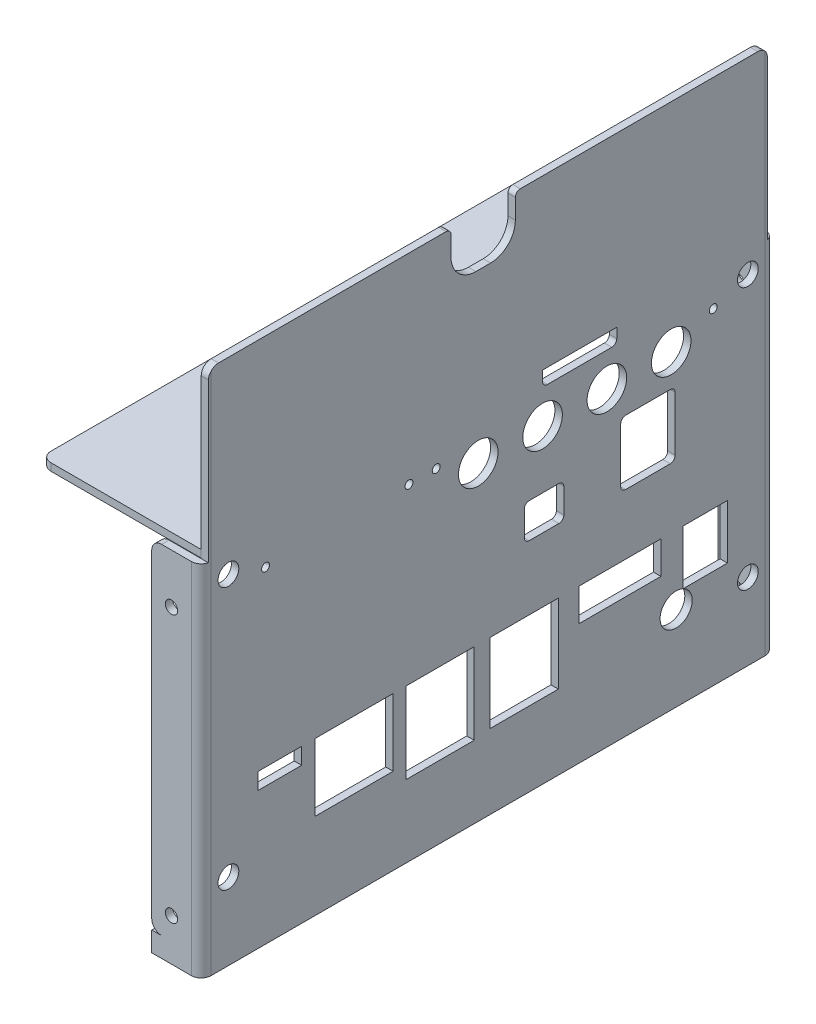
from build123d import *

# Parameters (mm, degrees)
CROQUIS1_W                          = 82.4
CROQUIS1_H                          = 70
SALIENTE_EXTRUIR1_DEPTH             = 34
CROQUIS2_W                          = 15
CROQUIS2_H                          = 70
CORTAR_EXTRUIR1_DEPTH               = 0.1
CROQUIS3_W                          = 1.5
CROQUIS3_H                          = 15
CORTAR_EXTRUIR2_DEPTH               = 1.5
CORTAR_EXTRUIR3_DEPTH               = 68.5
CROQUIS5_W                          = 1.5
CROQUIS5_H                          = 15
CORTAR_EXTRUIR4_DEPTH               = 3
SALIENTE_EXTRUIR2_DEPTH             = 30.4
CROQUIS7_W                          = 1.5
CROQUIS7_H                          = 68.5
SALIENTE_EXTRUIR3_DEPTH             = 1.6
CROQUIS8_W                          = 1.5
CROQUIS8_H                          = 68.5
SALIENTE_EXTRUIR4_DEPTH             = 8.5
CROQUIS9_W                          = 1.5
CROQUIS9_H                          = 68.5
SALIENTE_EXTRUIR5_DEPTH             = 1.6
CROQUIS10_W                         = 1.5
CROQUIS10_H                         = 68.5
SALIENTE_EXTRUIR6_DEPTH             = 8.5
CROQUIS11_W                         = 10
CROQUIS11_H                         = 13
CORTAR_EXTRUIR5_DEPTH               = 108.142428571
CROQUIS12_W                         = 8
CROQUIS12_H                         = 7
CORTAR_EXTRUIR6_DEPTH               = 84.025598462
CROQUIS13_W                         = 11
CROQUIS13_H                         = 13
CORTAR_EXTRUIR7_DEPTH               = 84.025598462
CORTAR_EXTRUIR8_DEPTH               = 84.025598462
CROQUIS15_W                         = 13.55
CROQUIS15_H                         = 6
CORTAR_EXTRUIR9_DEPTH               = 84.025598462
CROQUIS16_W                         = 13.55
CROQUIS16_H                         = 6
CORTAR_EXTRUIR10_DEPTH              = 84.025598462
CORTAR_EXTRUIR11_DEPTH              = 84.025598462
CROQUIS18_W                         = 26.5
CROQUIS18_H                         = 6.5
CORTAR_EXTRUIR12_DEPTH              = 84.025598462
CROQUIS19_W                         = 26.5
CROQUIS19_H                         = 6.5
CORTAR_EXTRUIR13_DEPTH              = 84.025598462
CORTAR_EXTRUIR14_DEPTH              = 83.42269105
DI_METRO_DE_TALADRO_8_0_8_1_D       = 8
DI_METRO_DE_TALADRO_6_5_6_5_1_D     = 6.5
DI_METRO_DE_TALADRO_2_5_2_5_1_D     = 2.5
DI_METRO_DE_TALADRO_2_5_2_5_1_DEPTH = 1.5
DI_METRO_DE_TALADRO_2_5_2_5_2_D     = 2.5
DI_METRO_DE_TALADRO_4_2_4_2_1_D     = 4.2
DI_METRO_DE_TALADRO_1_6_1_6_1_D     = 1.6
REDONDEO1_R                         = 0.3
REDONDEO2_R                         = 0.6
REDONDEO3_R                         = 0.8
REDONDEO4_R                         = 1
REDONDEO5_R                         = 1.5
REDONDEO6_R                         = 2
REDONDEO7_R                         = 5
SALIENTE_EXTRUIR7_DEPTH             = 4
CROQUIS38_W                         = 73.889858769
CROQUIS38_H                         = 28.929758263
SALIENTE_EXTRUIR8_DEPTH             = 1.5
CROQUIS39_W                         = 8.790000004
CROQUIS39_H                         = 3.326200024
CROQUIS39_W_2                       = 15.787775455
CROQUIS39_H_2                       = 13.619982862
CROQUIS39_W_3                       = 13.8
CROQUIS39_H_3                       = 16.3862
CROQUIS39_H_4                       = 15.9362
CROQUIS39_W_4                       = 16.586962118
CROQUIS39_H_5                       = 6.568107071
CROQUIS39_W_5                       = 9
CROQUIS39_H_6                       = 10.97
CORTAR_EXTRUIR15_DEPTH              = 1.5
CROQUIS45_W                         = 1.5
CROQUIS45_H                         = 113
SALIENTE_EXTRUIR9_DEPTH             = 34
REDONDEO8_R                         = 2
CROQUIS46_W                         = 13
CROQUIS46_H                         = 10
CORTAR_EXTRUIR16_DEPTH              = 1.5
REDONDEO9_R                         = 1
REDONDEO10_R                        = 5
REDONDEO11_START                    = -52
REDONDEO11_DEPTH                    = 107


with BuildPart() as part:
    # Croquis1 → Saliente-Extruir1 (new body)
    with BuildSketch(Plane(origin=(57.5, 0, 0), x_dir=(0, 0, -1), z_dir=(1, 0, 0))):
        with Locations((-16.2, -12.5)):
            Rectangle(CROQUIS1_W, CROQUIS1_H)
    extrude(amount=-SALIENTE_EXTRUIR1_DEPTH)

    # Croquis2 → Cortar-Extruir1 (cut)
    with BuildSketch(Plane(origin=(56, 0, 0), x_dir=(0, 0, -1), z_dir=(1, 0, 0))):
        with Locations((17.5, -12.5)):
            Rectangle(CROQUIS2_W, CROQUIS2_H)
    extrude(amount=-CORTAR_EXTRUIR1_DEPTH, mode=Mode.SUBTRACT)

    # Croquis3 → Cortar-Extruir2 (cut)
    with BuildSketch(Plane(origin=(0, 22.5, 0), x_dir=(-1, 0, 0), z_dir=(0, 1, 0))):
        with Locations((-56.75, -17.5)):
            Rectangle(CROQUIS3_W, CROQUIS3_H)
    extrude(amount=-CORTAR_EXTRUIR2_DEPTH, mode=Mode.SUBTRACT)

    # Croquis4 → Cortar-Extruir3 (cut)
    with BuildSketch(Plane.XZ.offset(47.5)):
        Polygon((23.5, -25), (55.9, -25), (55.9, -10), (56, -10), (56, 57.4), (23.5, 57.4), align=None)
    extrude(amount=-CORTAR_EXTRUIR3_DEPTH, mode=Mode.SUBTRACT)

    # Croquis5 → Cortar-Extruir4 (cut)
    with BuildSketch(Plane(origin=(0, 21, 0), x_dir=(-1, 0, 0), z_dir=(0, 1, 0))):
        with Locations((-56.75, -17.5)):
            Rectangle(CROQUIS5_W, CROQUIS5_H)
    extrude(amount=-CORTAR_EXTRUIR4_DEPTH, mode=Mode.SUBTRACT)

    # Croquis6 → Saliente-Extruir2 (add)
    with BuildSketch(Plane(origin=(0, 0, -25), x_dir=(-1, 0, 0), z_dir=(0, 0, -1))):
        Polygon((-57.5, 22.5), (-23.5, 22.5), (-23.5, 21), (-56, 21), (-56, -47.5), (-57.5, -47.5), align=None)
    extrude(amount=SALIENTE_EXTRUIR2_DEPTH)

    # Croquis7 → Saliente-Extruir3 (add)
    with BuildSketch(Plane(origin=(0, 0, -55.4), x_dir=(-1, 0, 0), z_dir=(0, 0, -1))):
        with Locations((-56.75, -13.25)):
            Rectangle(CROQUIS7_W, CROQUIS7_H)
    extrude(amount=SALIENTE_EXTRUIR3_DEPTH)

    # Croquis8 → Saliente-Extruir4 (add)
    with BuildSketch(Plane.ZY.offset(-56)):
        with Locations((-56.25, -13.25)):
            Rectangle(CROQUIS8_W, CROQUIS8_H)
    extrude(amount=SALIENTE_EXTRUIR4_DEPTH)

    # Croquis9 → Saliente-Extruir5 (add)
    with BuildSketch(Plane.XY.offset(57.4)):
        with Locations((56.75, -13.25)):
            Rectangle(CROQUIS9_W, CROQUIS9_H)
    extrude(amount=SALIENTE_EXTRUIR5_DEPTH)

    # Croquis10 → Saliente-Extruir6 (add)
    with BuildSketch(Plane.ZY.offset(-56)):
        with Locations((58.25, -13.25)):
            Rectangle(CROQUIS10_W, CROQUIS10_H)
    extrude(amount=SALIENTE_EXTRUIR6_DEPTH)

    # Croquis11 → Cortar-Extruir5 (cut, through all)
    with BuildSketch(Plane.XZ.offset(-21)):
        with Locations((28.5, 1)):
            Rectangle(CROQUIS11_W, CROQUIS11_H)
    extrude(amount=-CORTAR_EXTRUIR5_DEPTH, mode=Mode.SUBTRACT)

    # Croquis12 → Cortar-Extruir6 (cut, through all)
    with BuildSketch(Plane(origin=(57.5, 0, 0), x_dir=(0, 0, -1), z_dir=(1, 0, 0))):
        with Locations((10.3, -4)):
            Rectangle(CROQUIS12_W, CROQUIS12_H)
    extrude(amount=-CORTAR_EXTRUIR6_DEPTH, mode=Mode.SUBTRACT)

    # Croquis13 → Cortar-Extruir7 (cut, through all)
    with BuildSketch(Plane(origin=(57.5, 0, 0), x_dir=(0, 0, -1), z_dir=(1, 0, 0))):
        with Locations((31.3, -1.8)):
            Rectangle(CROQUIS13_W, CROQUIS13_H)
    extrude(amount=-CORTAR_EXTRUIR7_DEPTH, mode=Mode.SUBTRACT)

    # Croquis14 → Cortar-Extruir8 (cut, through all)
    with BuildSketch(Plane(origin=(57.5, 0, 0), x_dir=(0, 0, -1), z_dir=(1, 0, 0))):
        Polygon((15.700301919, -27.5), (25.899698081, -27.5), (27.125480126, -26.163699024), (28.6, -25.510897439), (28.6, -21.3), (13, -21.3), (13, -25.510897439), (14.474519874, -26.163699024), align=None)
    extrude(amount=-CORTAR_EXTRUIR8_DEPTH, mode=Mode.SUBTRACT)

    # Croquis15 → Cortar-Extruir9 (cut, through all)
    with BuildSketch(Plane(origin=(57.5, 0, 0), x_dir=(0, 0, -1), z_dir=(1, 0, 0))):
        with Locations((-17.1, -20.65)):
            Rectangle(CROQUIS15_W, CROQUIS15_H)
    extrude(amount=-CORTAR_EXTRUIR9_DEPTH, mode=Mode.SUBTRACT)

    # Croquis16 → Cortar-Extruir10 (cut, through all)
    with BuildSketch(Plane(origin=(57.5, 0, 0), x_dir=(0, 0, -1), z_dir=(1, 0, 0))):
        with Locations((-17.1, -29.15)):
            Rectangle(CROQUIS16_W, CROQUIS16_H)
    extrude(amount=-CORTAR_EXTRUIR10_DEPTH, mode=Mode.SUBTRACT)

    # Croquis17 → Cortar-Extruir11 (cut, through all)
    with BuildSketch(Plane(origin=(57.5, 0, 0), x_dir=(0, 0, -1), z_dir=(1, 0, 0))):
        Polygon((-5.75, -31.4), (8.95, -31.4), (8.95, -21.4), (4.1, -21.4), (4.1, -20.2), (-0.9, -20.2), (-0.9, -21.4), (-5.75, -21.4), align=None)
    extrude(amount=-CORTAR_EXTRUIR11_DEPTH, mode=Mode.SUBTRACT)

    # Croquis18 → Cortar-Extruir12 (cut, through all)
    with BuildSketch(Plane(origin=(57.5, 0, 0), x_dir=(0, 0, -1), z_dir=(1, 0, 0))):
        with Locations((-15.25, -38.85)):
            Rectangle(CROQUIS18_W, CROQUIS18_H)
    extrude(amount=-CORTAR_EXTRUIR12_DEPTH, mode=Mode.SUBTRACT)

    # Croquis19 → Cortar-Extruir13 (cut, through all)
    with BuildSketch(Plane(origin=(57.5, 0, 0), x_dir=(0, 0, -1), z_dir=(1, 0, 0))):
        with Locations((13.25, -38.85)):
            Rectangle(CROQUIS19_W, CROQUIS19_H)
    extrude(amount=-CORTAR_EXTRUIR13_DEPTH, mode=Mode.SUBTRACT)

    # Croquis20 → Cortar-Extruir14 (cut, through all)
    with BuildSketch(Plane.ZY.offset(-56)):
        Polygon((35.43492424, -26.5), (36.5, -25.43492424), (36.5, -20.8), (27.9, -20.8), (27.9, -25.43492424), (28.96507576, -26.5), align=None)
    extrude(amount=-CORTAR_EXTRUIR14_DEPTH, mode=Mode.SUBTRACT)

    # Diámetro de taladro Ø8.0 (8)1 (through all)
    with Locations(Plane.ZY.offset(-56)):
        with Locations((-23, 11.2), (3, 11.2), (-36, 11.2), (-10, 11.2)):
            Hole(DI_METRO_DE_TALADRO_8_0_8_1_D / 2)

    # Diámetro de taladro Ø6.5 (6.5)1 (through all)
    with Locations(Plane.ZY.offset(-56)):
        with Locations((-37, -34.4)):
            Hole(DI_METRO_DE_TALADRO_6_5_6_5_1_D / 2)

    # Diámetro de taladro Ø2.5 (2.5)1
    with Locations(Plane(origin=(0, 0, 57.5), x_dir=(-1, 0, 0), z_dir=(0, 0, -1))):
        with Locations((-51.5, -43), (-51.5, 11)):
            Hole(DI_METRO_DE_TALADRO_2_5_2_5_1_D / 2, depth=DI_METRO_DE_TALADRO_2_5_2_5_1_DEPTH)

    # Diámetro de taladro Ø2.5 (2.5)2 (through all)
    with Locations(Plane.XY.offset(-55.5)):
        with Locations((51.5, -43), (51.5, 11)):
            Hole(DI_METRO_DE_TALADRO_2_5_2_5_2_D / 2)

    # Diámetro de taladro Ø4.2 (4.2)1 (through all)
    with Locations(Plane.ZY.offset(-56)):
        with Locations((53.5, 17), (53.5, -36), (-51.5, 17), (-51.5, -36)):
            Hole(DI_METRO_DE_TALADRO_4_2_4_2_1_D / 2)

    # Diámetro de taladro Ø1.6 (1.6)1 (through all)
    with Locations(Plane.ZY.offset(-56)):
        with Locations((11.5, 14.5), (-44.5, 14.5), (46, 14.5), (17, 14.5)):
            Hole(DI_METRO_DE_TALADRO_1_6_1_6_1_D / 2)

    # Redondeo1
    redondeo1_edges = [part.edges().sort_by_distance(p)[0] for p in [
        (56.75, -20.2, 0.9),
        (56.75, -20.2, -4.1),
    ]]
    fillet(redondeo1_edges, radius=REDONDEO1_R)

    # Redondeo2
    redondeo2_edges = [part.edges().sort_by_distance(p)[0] for p in [
        (56.75, -23.65, 23.875),
        (56.75, -17.65, 23.875),
        (56.75, -17.65, 10.325),
        (56.75, -23.65, 10.325),
        (56.75, -32.15, 23.875),
        (56.75, -26.15, 23.875),
        (56.75, -26.15, 10.325),
        (56.75, -32.15, 10.325),
    ]]
    fillet(redondeo2_edges, radius=REDONDEO2_R)

    # Redondeo3
    redondeo3_edges = [part.edges().sort_by_distance(p)[0] for p in [
        (56.75, -31.4, 5.75),
        (56.75, -21.4, 5.75),
        (56.75, -21.4, 0.9),
        (56.75, -21.4, -4.1),
        (56.75, -21.4, -8.95),
        (56.75, -31.4, -8.95),
        (56.75, -20.8, 27.9),
        (56.75, -20.8, 36.5),
    ]]
    fillet(redondeo3_edges, radius=REDONDEO3_R)

    # Redondeo4
    redondeo4_edges = [part.edges().sort_by_distance(p)[0] for p in [
        (23.5, 21.75, 7.5),
        (23.5, 21.75, -5.5),
        (56.75, -7.5, -14.3),
        (56.75, -7.5, -6.3),
        (56.75, -0.5, -6.3),
        (56.75, -0.5, -14.3),
        (56.75, 4.7, -36.8),
        (56.75, -8.3, -36.8),
        (56.75, -8.3, -25.8),
        (56.75, 4.7, -25.8),
        (56.75, -27.5, -15.700301919),
        (56.75, -26.163699024, -14.474519874),
        (56.75, -25.510897439, -13),
        (56.75, -21.3, -13),
        (56.75, -21.3, -28.6),
        (56.75, -25.510897439, -28.6),
        (56.75, -26.163699024, -27.125480126),
        (56.75, -27.5, -25.899698081),
        (56.75, -35.6, 28.5),
        (56.75, -35.6, 2),
        (56.75, -42.1, 2),
        (56.75, -42.1, 28.5),
        (56.75, -42.1, 0),
        (56.75, -35.6, 0),
        (56.75, -35.6, -26.5),
        (56.75, -42.1, -26.5),
        (56.75, -26.5, 35.43492424),
        (56.75, -26.5, 28.96507576),
        (56.75, -25.43492424, 27.9),
        (56.75, -25.43492424, 36.5),
        (56.75, 18, -10),
        (56.75, 18, -25),
    ]]
    fillet(redondeo4_edges, radius=REDONDEO4_R)

    # Redondeo5
    redondeo5_edges = [part.edges().sort_by_distance(p)[0] for p in [
        (57.5, -13.25, 59),
        (57.5, -13.25, -57),
        (57.5, 22.5, 23.7),
        (57.5, 22.5, -40.2),
    ]]
    fillet(redondeo5_edges, radius=REDONDEO5_R)

    # Redondeo6
    redondeo6_edges = [part.edges().sort_by_distance(p)[0] for p in [
        (47.5, 21, -56.25),
        (47.5, -47.5, -56.25),
        (47.5, 21, 58.25),
        (47.5, -47.5, 58.25),
        (23.5, 21.75, 57.4),
        (23.5, 21.75, -55.4),
    ]]
    fillet(redondeo6_edges, radius=REDONDEO6_R)

    # Redondeo7
    redondeo7_edges = [part.edges().sort_by_distance(p)[0] for p in [
        (33.5, 21.75, 7.5),
        (33.5, 21.75, -5.5),
    ]]
    fillet(redondeo7_edges, radius=REDONDEO7_R)

    # Croquis33 → Saliente-Extruir7 (add)
    with BuildSketch(Plane.XZ.offset(47.5)):
        Polygon((56, 57.5), (56, -55.5), (47.5, -55.5), (47.5, -57), (57.5, -57), (57.5, -55.5), (57.5, 57.5), (57.5, 59), (47.5, 59), (47.5, 57.5), align=None)
    extrude(amount=SALIENTE_EXTRUIR7_DEPTH)

    # Croquis38 → Saliente-Extruir8 (add)
    with BuildSketch(Plane(origin=(57.5, 0, 0), x_dir=(0, 0, -1), z_dir=(1, 0, 0))):
        with Locations((-4.631874415, -31.532238632)):
            Rectangle(CROQUIS38_W, CROQUIS38_H)
    extrude(amount=-SALIENTE_EXTRUIR8_DEPTH)

    # Croquis39 → Cortar-Extruir15 (cut)
    with BuildSketch(Plane(origin=(57.5, 0, 0), x_dir=(0, 0, -1), z_dir=(1, 0, 0))):
        with Locations((-43.094172143, -22.163100012)):
            Rectangle(CROQUIS39_W, CROQUIS39_H)
        with Locations((-28.094344071, -27.309991431)):
            Rectangle(CROQUIS39_W_2, CROQUIS39_H_2)
        with Locations((-10.714172145, -28.6931)):
            Rectangle(CROQUIS39_W_3, CROQUIS39_H_3)
        with Locations((6.285827855, -28.4681)):
            Rectangle(CROQUIS39_W_3, CROQUIS39_H_4)
        with Locations((25.630515076, -23.784053536)):
            Rectangle(CROQUIS39_W_4, CROQUIS39_H_5)
        with Locations((42.885827855, -25.985)):
            Rectangle(CROQUIS39_W_5, CROQUIS39_H_6)
    extrude(amount=-CORTAR_EXTRUIR15_DEPTH, mode=Mode.SUBTRACT)

    # Croquis45 → Saliente-Extruir9 (add)
    with BuildSketch(Plane(origin=(0, 21, 0), x_dir=(1, 0, 0), z_dir=(0, 1, 0))):
        with Locations((56.75, -1)):
            Rectangle(CROQUIS45_W, CROQUIS45_H)
    extrude(amount=SALIENTE_EXTRUIR9_DEPTH)

    # Redondeo8
    redondeo8_edges = [part.edges().sort_by_distance(p)[0] for p in [
        (56.75, 55, 57.5),
        (56.75, 55, -55.5),
    ]]
    fillet(redondeo8_edges, radius=REDONDEO8_R)

    # Croquis46 → Cortar-Extruir16 (cut)
    with BuildSketch(Plane.ZY.offset(-56)):
        with Locations((2, 50)):
            Rectangle(CROQUIS46_W, CROQUIS46_H)
    extrude(amount=-CORTAR_EXTRUIR16_DEPTH, mode=Mode.SUBTRACT)

    # Redondeo9
    redondeo9_edges = [part.edges().sort_by_distance(p)[0] for p in [
        (56.75, 55, 8.5),
        (56.75, 55, -4.5),
    ]]
    fillet(redondeo9_edges, radius=REDONDEO9_R)

    # Redondeo10
    redondeo10_edges = [part.edges().sort_by_distance(p)[0] for p in [
        (56.75, 45, 8.5),
        (56.75, 45, -4.5),
    ]]
    fillet(redondeo10_edges, radius=REDONDEO10_R)

    # Redondeo11: read off the stored shape, not the designer's step
    # Redondeo11 outline → Redondeo11 (cut)
    with BuildSketch(Plane(origin=(0, 0, 0), x_dir=(1, 0, 0), z_dir=(0, 1, 0)).offset(REDONDEO11_START)):
        with BuildLine():
            ThreePointArc((57.5, -57), (56.914213562, -58.414213562), (55.5, -59))
            Line((55.5, -59), (57.5, -59))
            Line((57.5, -59), (57.5, -57))
        make_face()
        with BuildLine():
            Line((57.5, 55), (57.5, 57))
            Line((57.5, 57), (55.5, 57))
            ThreePointArc((55.5, 57), (56.914213562, 56.414213562), (57.5, 55))
        make_face()
    extrude(amount=REDONDEO11_DEPTH, mode=Mode.SUBTRACT)


solid = part.part
